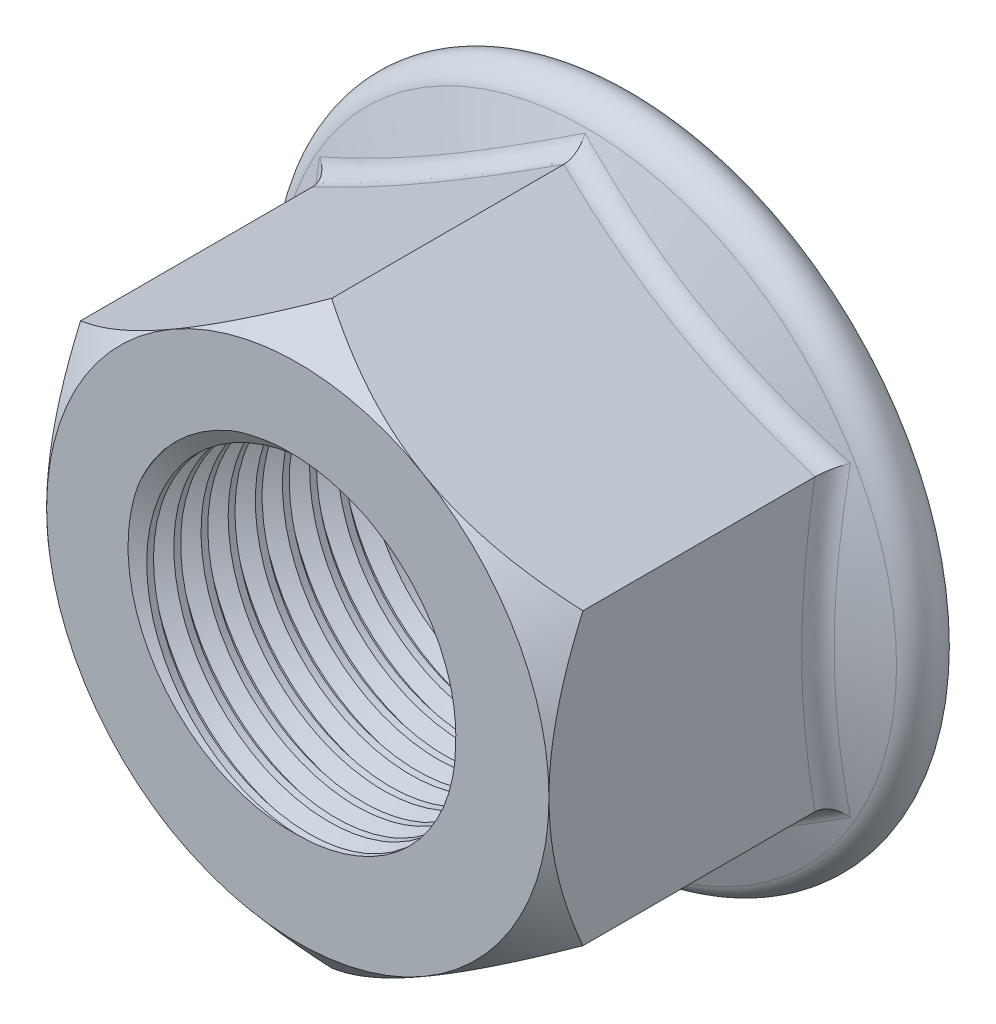
from build123d import *

# Parameters (mm, degrees)
BASENUT_DEPTH            = 10
FLANGEFILLET_R           = 0.6
M5_CLEARANCE_HOLE2_D     = 9.3
M5_CLEARANCE_HOLE2_DEPTH = 12
M5_CLEARANCE_HOLE2_TIP   = 2.794001878
THREAD1_PITCH            = 0.8


with BuildPart() as part:
    # BaseNutSke → BaseNut (new body)
    with BuildSketch(Plane.XY):
        Polygon((7.4, 4.272391992), (7.4, -4.272391992), (0, -8.544783984), (-7.4, -4.272391992), (-7.4, 4.272391992), (0, 8.544783984), align=None)
    extrude(amount=-BASENUT_DEPTH)

    # Sketch6 → Flange (revolve)
    with BuildSketch(Plane(origin=(0, 0, 0), x_dir=(0, 0, -1), z_dir=(1, 0, 0)), mode=Mode.PRIVATE) as flange_sk:
        with BuildLine():
            Line((6.86534705, 4.65), (8.5, 9.141172068))
            ThreePointArc((8.5, 9.141172068), (9.360966928, 9.638251556), (10, 8.876681597))
            Line((10, 8.876681597), (10, 4.65))
            Line((10, 4.65), (6.86534705, 4.65))
        make_face()
    revolve(flange_sk.sketch.rotate(Axis((0, 0, 0), (0, 0, -1)), 90), axis=Axis((0, 0, 0), (0, 0, -1)))

    # Sketch3 → Double-Chamfer (revolve, cut)
    with BuildSketch(Plane(origin=(0, 0, 0), x_dir=(0, 0, -1), z_dir=(1, 0, 0)), mode=Mode.PRIVATE) as double_chamfer_sk:
        Polygon((-1.290425684, 7.4), (0, 7.4), (1, 8.544783984), (1, 10.311512121), (-1.290425684, 10.311512121), align=None)
    revolve(double_chamfer_sk.sketch.rotate(Axis((0, 0, 0), (0, 0, -1)), 90), axis=Axis((0, 0, 0), (0, 0, -1)), mode=Mode.SUBTRACT)

    # FlangeFillet
    flangefillet_edges = [part.edges().sort_by_distance(p)[0] for p in [
        (7.4, -2.145514777, -7.977186567),
        (7.4, 2.145514777, -7.977186567),
        (3.7, -6.408587988, -7.866265195),
        (3.7, 6.408587988, -7.866265195),
        (-3.7, 6.408587988, -7.866265195),
        (-7.4, 0, -7.866265195),
        (-3.7, -6.408587988, -7.866265195),
    ]]
    fillet(flangefillet_edges, radius=FLANGEFILLET_R)

    # M5 Clearance Hole2
    with Locations(Plane(origin=(0, 0, -10), x_dir=(-1, 0, 0), z_dir=(0, 0, -1))):
        with Locations((0, 0)):
            Hole(M5_CLEARANCE_HOLE2_D / 2, depth=M5_CLEARANCE_HOLE2_DEPTH)
            with Locations((0, 0, -(M5_CLEARANCE_HOLE2_DEPTH + M5_CLEARANCE_HOLE2_TIP / 2))):  # 118° drill point
                Cone(0, M5_CLEARANCE_HOLE2_D / 2, M5_CLEARANCE_HOLE2_TIP, mode=Mode.SUBTRACT)

    # Thread1: the profile of Thread Profile1 profile screwed along a right-hand helix of 13.75 turns, 8 arcs to a turn; built about Z, then put on its axis
    thread1_z = Axis((0, 0, 0), (0, 0, 1))
    thread1_corners = [(4.6497, 0, -0.000173205), (5.0830127, 0, 0.249999999), (5.0830127, 0, 0.349999999), (4.6497, 0, 0.600173203)]
    with BuildLine(mode=Mode.PRIVATE) as thread1_profile:
        Line(thread1_corners[0], thread1_corners[1])
        Line(thread1_corners[1], thread1_corners[2])
        Line(thread1_corners[2], thread1_corners[3])
        Line(thread1_corners[3], thread1_corners[0])
    thread1_cap = Face(thread1_profile.wire())
    thread1_turn_angles = [0, 22.5, 45, 67.5, 90, 112.5, 135, 157.5, 180, 202.5, 225, 247.5, 270, 292.5, 315, 337.5, 360]
    thread1_turn_weights = [1, 0.9238795325112867, 1, 0.9238795325112867, 1, 0.9238795325112867, 1, 0.9238795325112867, 1, 0.9238795325112867, 1, 0.9238795325112867, 1, 0.9238795325112867, 1, 0.9238795325112867, 1]
    thread1_turn_rails = [Edge.make_bspline([Vector(p[0], p[1], 0).rotate(thread1_z, thread1_turn_angles[k]) / thread1_turn_weights[k] + Vector(0, 0, p[2] + THREAD1_PITCH * thread1_turn_angles[k] / 360) for k in range(17)], [0, 0, 0, 1, 1, 2, 2, 3, 3, 4, 4, 5, 5, 6, 6, 7, 7, 8, 8, 8], 2, thread1_turn_weights) for p in thread1_corners]
    thread1_turn_sides = [Face.make_surface_from_curves(thread1_turn_rails[p[0]], thread1_turn_rails[p[1]]) for p in [(0, 1), (1, 2), (2, 3), (3, 0)]]
    thread1_last_angles = [4680, 4702.5, 4725, 4747.5, 4770, 4792.5, 4815, 4837.5, 4860, 4882.5, 4905, 4927.5, 4950]
    thread1_last_weights = [1, 0.9238795325112867, 1, 0.9238795325112867, 1, 0.9238795325112867, 1, 0.9238795325112867, 1, 0.9238795325112867, 1, 0.9238795325112867, 1]
    thread1_last_rails = [Edge.make_bspline([Vector(p[0], p[1], 0).rotate(thread1_z, thread1_last_angles[k]) / thread1_last_weights[k] + Vector(0, 0, p[2] + THREAD1_PITCH * thread1_last_angles[k] / 360) for k in range(13)], [0, 0, 0, 1, 1, 2, 2, 3, 3, 4, 4, 5, 5, 6, 6, 6], 2, thread1_last_weights) for p in thread1_corners]
    thread1_last_sides = [Face.make_surface_from_curves(thread1_last_rails[p[0]], thread1_last_rails[p[1]]) for p in [(0, 1), (1, 2), (2, 3), (3, 0)]]
    thread1 = Plane(origin=(0, 0, -11), x_dir=(1, 0, 0), z_dir=(0, 0, 1)) * Solid(Shell([*[p.moved(Location((0, 0, THREAD1_PITCH * i))) for i in range(13) for p in thread1_turn_sides], *thread1_last_sides, thread1_cap, thread1_cap.rotate(thread1_z, 4950).moved(Location((0, 0, THREAD1_PITCH * 4950 / 360)))]))
    add(thread1, mode=Mode.SUBTRACT)


solid = part.part
